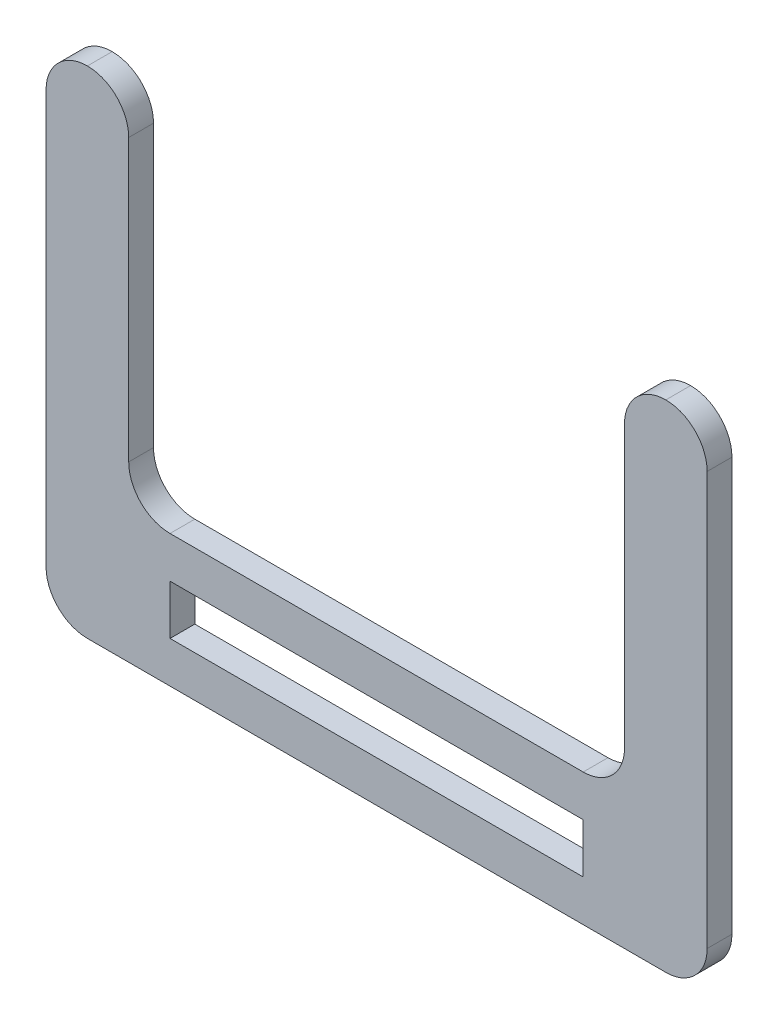
from build123d import *

# Parameters (mm, degrees)
EXTRUSION1_DEPTH        = 3
ESQUISSE2_W             = 50
ESQUISSE2_H             = 6
ENL_V_MAT_EXTRU_1_DEPTH = 6
CONG_1_R                = 5


with BuildPart() as part:
    # Esquisse1 → Extrusion1 (new body)
    with BuildSketch(Plane.XY):
        Polygon((-63.845510563, 55.495422535), (-53.845510563, 55.495422535), (-53.845510563, 11.495422535), (6.154489437, 11.495422535), (6.154489437, 55.495422535), (16.154489437, 55.495422535), (16.154489437, -4.504577465), (-63.845510563, -4.504577465), align=None)
    extrude(amount=EXTRUSION1_DEPTH)

    # Esquisse2 → Enlèv. mat.-Extru.1 (cut)
    with BuildSketch(Plane.XY.offset(3)):
        with Locations((-23.845510563, 3.495422535)):
            Rectangle(ESQUISSE2_W, ESQUISSE2_H)
    extrude(amount=-ENL_V_MAT_EXTRU_1_DEPTH, mode=Mode.SUBTRACT)

    # Congé1
    cong_1_edges = [part.edges().sort_by_distance(p)[0] for p in [
        (-53.845510563, 11.495422535, 1.5),
        (6.154489437, 11.495422535, 1.5),
        (16.154489437, 55.495422535, 1.5),
        (6.154489437, 55.495422535, 1.5),
        (-53.845510563, 55.495422535, 1.5),
        (-63.845510563, 55.495422535, 1.5),
        (16.154489437, -4.504577465, 1.5),
        (-63.845510563, -4.504577465, 1.5),
    ]]
    fillet(cong_1_edges, radius=CONG_1_R - 0.0001)  # a hair under: the kernel refuses the full size


solid = part.part
